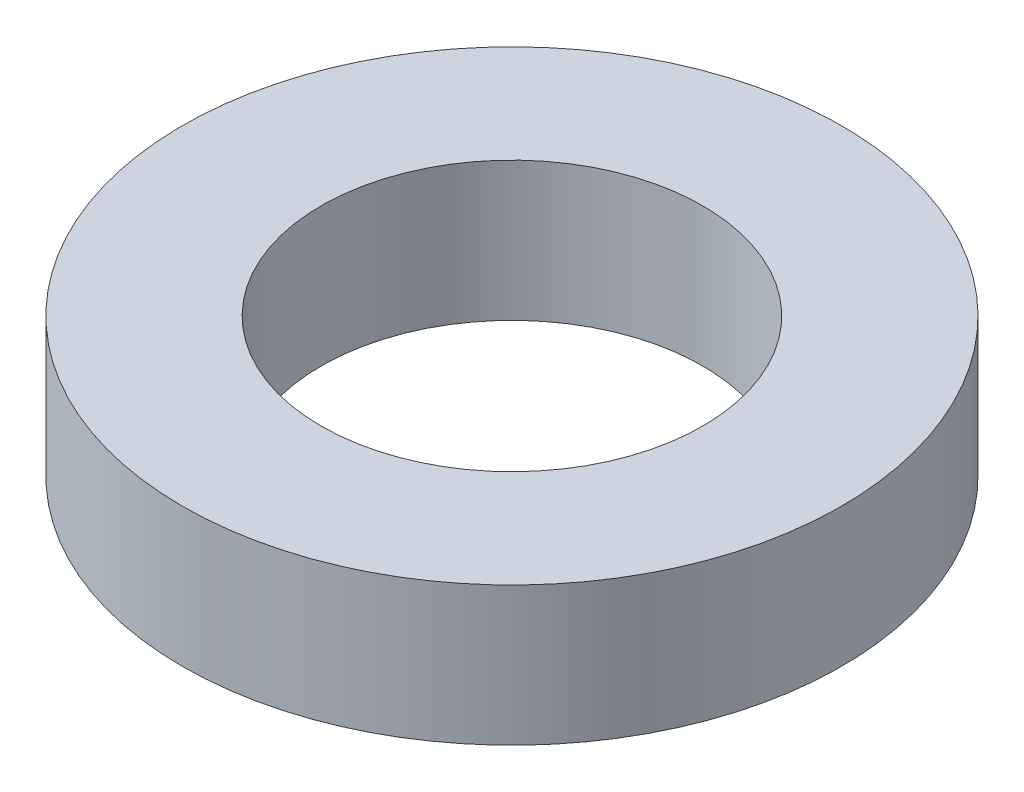
from build123d import *

# Parameters (mm, degrees)
SKETCH1_R           = 47.5
BOSS_EXTRUDE1_DEPTH = 20
SKETCH2_R           = 27.5
CUT_EXTRUDE1_DEPTH  = 71.089228844


with BuildPart() as part:
    # Sketch1 → Boss-Extrude1 (new body)
    with BuildSketch(Plane(origin=(0, 0, 0), x_dir=(1, 0, 0), z_dir=(0, 1, 0))):
        Circle(SKETCH1_R)
    extrude(amount=BOSS_EXTRUDE1_DEPTH)

    # Sketch2 → Cut-Extrude1 (cut, through all)
    with BuildSketch(Plane(origin=(0, 0, 0), x_dir=(1, 0, 0), z_dir=(0, 1, 0))):
        Circle(SKETCH2_R)
    extrude(amount=CUT_EXTRUDE1_DEPTH, mode=Mode.SUBTRACT)


solid = part.part
